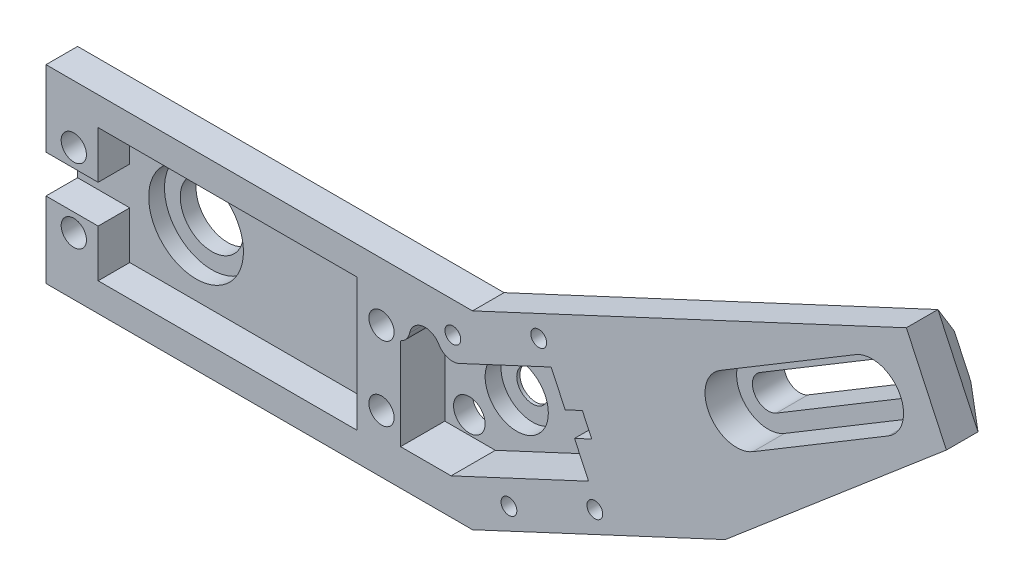
from build123d import *

# Parameters (mm, degrees)
SKETCH1_W                = 57.5
SKETCH1_H                = 30
BOSS_EXTRUDE1_DEPTH      = 30
SKETCH2_W                = 41
SKETCH2_H                = 21
CUT_EXTRUDE1_DEPTH       = 25
SKETCH8_R                = 2
CUT_EXTRUDE6_DEPTH       = 10
SKETCH10_R               = 5
CUT_EXTRUDE8_DEPTH       = 10
BOSS_EXTRUDE4_DEPTH      = 30
SKETCH16_R               = 5
CUT_EXTRUDE10_DEPTH      = 30
CHAMFER5_SIZE            = 5
SKETCH20_R               = 7.5
CUT_EXTRUDE13_DEPTH      = 2.5
CUT_EXTRUDE16_DEPTH      = 122.918629513
CUT_EXTRUDE16_DEPTH_BACK = 122.918629513
SKETCH30_W               = 142.5
SKETCH30_H               = 20
CUT_EXTRUDE17_DEPTH      = 7
CUT_EXTRUDE19_DEPTH      = 124.489525441
SKETCH35_R               = 2.5
CUT_EXTRUDE21_DEPTH      = 124.489525441
SKETCH37_W               = 8.25
SKETCH37_H               = 6
CUT_EXTRUDE23_DEPTH      = 5
CUT_EXTRUDE24_DEPTH      = 5
SKETCH40_R               = 5
CUT_EXTRUDE25_DEPTH      = 2.5
SKETCH41_R               = 2
CUT_EXTRUDE26_DEPTH      = 10
CUT_EXTRUDE27_DEPTH      = 7
FILLET3_R                = 2.5
FILLET4_R                = 2.5
SKETCH45_R               = 1.25
CUT_EXTRUDE28_DEPTH      = 124.489525441


with BuildPart() as part:
    # Sketch1 → Boss-Extrude1 (new body)
    with BuildSketch(Plane.XY):
        Rectangle(SKETCH1_W, SKETCH1_H)
    extrude(amount=BOSS_EXTRUDE1_DEPTH)

    # Sketch2 → Cut-Extrude1 (cut)
    with BuildSketch(Plane.XY.offset(30)):
        Rectangle(SKETCH2_W, SKETCH2_H)
    extrude(amount=-CUT_EXTRUDE1_DEPTH, mode=Mode.SUBTRACT)

    # Sketch8 → Cut-Extrude6 (cut)
    with BuildSketch(Plane.XY.offset(30)):
        with Locations((24.35, 6)):
            Circle(SKETCH8_R)
        with Locations(Location((24.35, -6, 0), (0, 0, 180))):
            Circle(SKETCH8_R)
        with Locations((-24.35, -6)):
            Circle(SKETCH8_R)
        with Locations(Location((-24.35, 6, 0), (0, 0, 180))):
            Circle(SKETCH8_R)
    extrude(amount=-CUT_EXTRUDE6_DEPTH, mode=Mode.SUBTRACT)

    # Sketch10 → Cut-Extrude8 (cut)
    with BuildSketch(Plane.XY.offset(5)):
        with Locations((-10, 0)):
            Circle(SKETCH10_R)
    extrude(amount=-CUT_EXTRUDE8_DEPTH, mode=Mode.SUBTRACT)

    # Sketch13 → Boss-Extrude4 (add)
    with BuildSketch(Plane.XY.offset(30)):
        Polygon((28.75, 15), (38.75, 15), (107.410726074, 47.017022383), (113.75, 33.422405577), (78.75, 3.652306326), (38.75, -15), (28.75, -15), align=None)
    extrude(amount=-BOSS_EXTRUDE4_DEPTH)

    # Sketch16 → Cut-Extrude10 (cut)
    with BuildSketch(Plane(origin=(1.175656739, -2.521204013, 0), x_dir=(0.9063077870366488, 0.42261826174070183, 0), z_dir=(-0.42261826174070183, 0.9063077870366488, 0))):
        with Locations(Location((97.217429724, -15, 0), (0, 0, 180))):
            Circle(SKETCH16_R)
        with BuildLine():
            Line((67.217429724, -12.5), (82.217429724, -12.5))
            ThreePointArc((82.217429724, -12.5), (84.717429724, -15), (82.217429724, -17.5))
            Line((82.217429724, -17.5), (67.217429724, -17.5))
            ThreePointArc((67.217429724, -17.5), (64.717429724, -15), (67.217429724, -12.5))
        make_face()
    extrude(amount=-CUT_EXTRUDE10_DEPTH, mode=Mode.SUBTRACT)

    # Chamfer5
    # the kernel refuses this chamfer: 5 mm, written as the material it takes off along each edge
    with BuildSketch(Plane(origin=(-28.75, 27.85841494, 0), x_dir=(-0.027495876610586317, 0, 0.9996219169112968), z_dir=(0, -1, 0))) as chamfer5_piece_1:
        Polygon((CHAMFER5_SIZE * 0.999621916911, -CHAMFER5_SIZE * 0.0274958766106), (-CHAMFER5_SIZE * 0.0274958766106, -CHAMFER5_SIZE * 0.999621916911), (0, 0), align=None)
    extrude(amount=55.71682988, mode=Mode.SUBTRACT)
    with BuildSketch(Plane(origin=(-41.60841494, -15, 0), x_dir=(0, -0.027495876610586317, 0.9996219169112968), z_dir=(1, 0, 0)), Plane(origin=(51.60841494, -15, 30), x_dir=(0, -0.027495876610586317, -0.9996219169112968), z_dir=(-1, 0, 0))) as chamfer5_piece_2:
        Polygon((CHAMFER5_SIZE * 0.999621916911, -CHAMFER5_SIZE * 0.0274958766106), (-CHAMFER5_SIZE * 0.0274958766106, -CHAMFER5_SIZE * 0.999621916911), (0, 0), align=None)
    extrude(amount=93.21682988, mode=Mode.SUBTRACT)
    with BuildSketch(Plane(origin=(90.403681589, 9.086507297, 30), x_dir=(-0.4224584769229526, 0.905965127389214, 0.02749587661058631), z_dir=(-0.9063077870366526, -0.4226182617406939, 0)), Plane(origin=(90.403681589, 9.086507297, 0), x_dir=(0.011620259578202724, -0.024919727083573626, 0.9996219169112968), z_dir=(-0.9063077870366526, -0.4226182617406939, 0))) as chamfer5_piece_3:
        Polygon((CHAMFER5_SIZE * 0.999621916911, CHAMFER5_SIZE * 0.0274958766106), (-CHAMFER5_SIZE * 0.0274958766106, CHAMFER5_SIZE * 0.999621916911), (0, 0), align=None)
    extrude(amount=69.851946638, mode=Mode.SUBTRACT)
    with BuildSketch(Plane(origin=(123.544555766, 41.753402643, 0), x_dir=(-0.6476573741944397, 0.7614354223576539, -0.027495876610586414), z_dir=(-0.7617234170999287, -0.6479023351104763, 0))) as chamfer5_piece_4:
        Polygon((CHAMFER5_SIZE * 0.999621916911, -CHAMFER5_SIZE * 0.0274958766106), (-CHAMFER5_SIZE * 0.0274958766106, -CHAMFER5_SIZE * 0.999621916911), (0, 0), align=None)
    extrude(amount=71.665266299, mode=Mode.SUBTRACT)
    with BuildSketch(Plane(origin=(123.544555766, 41.753402643, 30), x_dir=(-0.6476573741944397, 0.7614354223576539, 0.02749587661058634), z_dir=(-0.7617234170999287, -0.6479023351104763, 0))) as chamfer5_piece_5:
        Polygon((CHAMFER5_SIZE * 0.999621916911, CHAMFER5_SIZE * 0.0274958766106), (-CHAMFER5_SIZE * 0.0274958766106, CHAMFER5_SIZE * 0.999621916911), (0, 0), align=None)
    extrude(amount=71.665266299, mode=Mode.SUBTRACT)
    with BuildSketch(Plane(origin=(101.976525103, 58.670703972, 30), x_dir=(-0.9059651273892108, -0.42245847692295924, 0.027495876610586337), z_dir=(0.42261826174070055, -0.9063077870366495, 0))) as chamfer5_piece_6:
        Polygon((CHAMFER5_SIZE * 0.999621916911, CHAMFER5_SIZE * 0.0274958766106), (-CHAMFER5_SIZE * 0.0274958766106, CHAMFER5_SIZE * 0.999621916911), (0, 0), align=None)
    extrude(amount=40.71682988, mode=Mode.SUBTRACT)
    with BuildSketch(Plane(origin=(101.976525103, 58.670703972, 0), x_dir=(-0.9059651273892108, -0.42245847692295924, -0.027495876610586344), z_dir=(0.42261826174070055, -0.9063077870366495, 0))) as chamfer5_piece_7:
        Polygon((CHAMFER5_SIZE * 0.999621916911, -CHAMFER5_SIZE * 0.0274958766106), (-CHAMFER5_SIZE * 0.0274958766106, -CHAMFER5_SIZE * 0.999621916911), (0, 0), align=None)
    extrude(amount=40.71682988, mode=Mode.SUBTRACT)
    with BuildSketch(Plane(origin=(27.096318411, 9.565799029, 30), x_dir=(0.4224584769229604, -0.9059651273892103, 0.027495876610586313), z_dir=(0.9063077870366489, 0.4226182617407018, 0))) as chamfer5_piece_8_section:
        Polygon((CHAMFER5_SIZE * 0.999621916911, CHAMFER5_SIZE * 0.0274958766106), (-CHAMFER5_SIZE * 0.0274958766106, CHAMFER5_SIZE * 0.999621916911), (0, 0), align=None)
    chamfer5_piece_8 = extrude(amount=101.47555893, mode=Mode.PRIVATE)
    chamfer5_piece_8 = split(chamfer5_piece_8, bisect_by=Plane(origin=(81.150743587, 15, 28.329639499), z_dir=(0, 1, 0)), keep=Keep.TOP, mode=Mode.PRIVATE)
    add(chamfer5_piece_8, mode=Mode.SUBTRACT)
    with BuildSketch(Plane(origin=(27.096318411, 9.565799029, 0), x_dir=(0.4224584769229604, -0.9059651273892103, -0.02749587661058636), z_dir=(0.9063077870366489, 0.4226182617407018, 0))) as chamfer5_piece_9_section:
        Polygon((CHAMFER5_SIZE * 0.999621916911, -CHAMFER5_SIZE * 0.0274958766106), (-CHAMFER5_SIZE * 0.0274958766106, -CHAMFER5_SIZE * 0.999621916911), (0, 0), align=None)
    chamfer5_piece_9 = extrude(amount=101.47555893, mode=Mode.PRIVATE)
    chamfer5_piece_9 = split(chamfer5_piece_9, bisect_by=Plane(origin=(81.150743587, 15, 1.670360501), z_dir=(0, 1, 0)), keep=Keep.TOP, mode=Mode.PRIVATE)
    add(chamfer5_piece_9, mode=Mode.SUBTRACT)
    with BuildSketch(Plane(origin=(-41.60841494, 15, 0), x_dir=(0, -0.9996219169112968, -0.027495876610586372), z_dir=(1, 0, 0))) as chamfer5_piece_10_section:
        Polygon((CHAMFER5_SIZE * 0.999621916911, -CHAMFER5_SIZE * 0.0274958766106), (-CHAMFER5_SIZE * 0.0274958766106, -CHAMFER5_SIZE * 0.999621916911), (0, 0), align=None)
    chamfer5_piece_10 = extrude(amount=93.21682988, mode=Mode.PRIVATE)
    chamfer5_piece_10 = split(chamfer5_piece_10, bisect_by=Plane(origin=(3.719146846, -1.335155097, 1.672660276), z_dir=(-0.4226182617407018, 0.9063077870366489, 0)), keep=Keep.TOP, mode=Mode.PRIVATE)
    add(chamfer5_piece_10, mode=Mode.SUBTRACT)
    with BuildSketch(Plane(origin=(51.60841494, 15, 30), x_dir=(0, -0.9996219169112968, 0.027495876610586317), z_dir=(-1, 0, 0))) as chamfer5_piece_11_section:
        Polygon((CHAMFER5_SIZE * 0.999621916911, -CHAMFER5_SIZE * 0.0274958766106), (-CHAMFER5_SIZE * 0.0274958766106, -CHAMFER5_SIZE * 0.999621916911), (0, 0), align=None)
    chamfer5_piece_11 = extrude(amount=93.21682988, mode=Mode.PRIVATE)
    chamfer5_piece_11 = split(chamfer5_piece_11, bisect_by=Plane(origin=(3.719146846, -1.335155097, 28.327339724), z_dir=(-0.4226182617407018, 0.9063077870366489, 0)), keep=Keep.TOP, mode=Mode.PRIVATE)
    add(chamfer5_piece_11, mode=Mode.SUBTRACT)
    with BuildSketch(Plane(origin=(27.096318411, 9.565799029, 30), x_dir=(0.4224584769229604, -0.9059651273892103, 0.027495876610586313), z_dir=(0.9063077870366489, 0.4226182617407018, 0))) as chamfer5_piece_12a_section:
        Polygon((CHAMFER5_SIZE * 0.999621916911, CHAMFER5_SIZE * 0.0274958766106), (-CHAMFER5_SIZE * 0.0274958766106, CHAMFER5_SIZE * 0.999621916911), (0, 0), align=None)
    chamfer5_piece_12a = extrude(amount=101.47555893, mode=Mode.PRIVATE)
    chamfer5_piece_12a = split(chamfer5_piece_12a, bisect_by=Plane(origin=(35.512062488, 15, 28.462048788), z_dir=(0, -1, 0)), keep=Keep.TOP, mode=Mode.PRIVATE)
    with BuildSketch(Plane(origin=(51.60841494, 15, 30), x_dir=(0, -0.9996219169112968, 0.027495876610586317), z_dir=(-1, 0, 0))) as chamfer5_piece_12b_section:
        Polygon((CHAMFER5_SIZE * 0.999621916911, -CHAMFER5_SIZE * 0.0274958766106), (-CHAMFER5_SIZE * 0.0274958766106, -CHAMFER5_SIZE * 0.999621916911), (0, 0), align=None)
    chamfer5_piece_12b = extrude(amount=93.21682988, mode=Mode.PRIVATE)
    chamfer5_piece_12b = split(chamfer5_piece_12b, bisect_by=Plane(origin=(41.684567981, 16.368411523, 28.462048788), z_dir=(0.4226182617407018, -0.9063077870366489, 0)), keep=Keep.TOP, mode=Mode.PRIVATE)
    chamfer5_piece_12 = chamfer5_piece_12a & chamfer5_piece_12b
    add(chamfer5_piece_12, mode=Mode.SUBTRACT)
    with BuildSketch(Plane(origin=(27.096318411, 9.565799029, 0), x_dir=(0.4224584769229604, -0.9059651273892103, -0.02749587661058636), z_dir=(0.9063077870366489, 0.4226182617407018, 0))) as chamfer5_piece_13a_section:
        Polygon((CHAMFER5_SIZE * 0.999621916911, -CHAMFER5_SIZE * 0.0274958766106), (-CHAMFER5_SIZE * 0.0274958766106, -CHAMFER5_SIZE * 0.999621916911), (0, 0), align=None)
    chamfer5_piece_13a = extrude(amount=101.47555893, mode=Mode.PRIVATE)
    chamfer5_piece_13a = split(chamfer5_piece_13a, bisect_by=Plane(origin=(35.512062488, 15, 1.537951212), z_dir=(0, -1, 0)), keep=Keep.TOP, mode=Mode.PRIVATE)
    with BuildSketch(Plane(origin=(-41.60841494, 15, 0), x_dir=(0, -0.9996219169112968, -0.027495876610586372), z_dir=(1, 0, 0))) as chamfer5_piece_13b_section:
        Polygon((CHAMFER5_SIZE * 0.999621916911, -CHAMFER5_SIZE * 0.0274958766106), (-CHAMFER5_SIZE * 0.0274958766106, -CHAMFER5_SIZE * 0.999621916911), (0, 0), align=None)
    chamfer5_piece_13b = extrude(amount=93.21682988, mode=Mode.PRIVATE)
    chamfer5_piece_13b = split(chamfer5_piece_13b, bisect_by=Plane(origin=(41.684567981, 16.368411523, 1.537951212), z_dir=(0.4226182617407018, -0.9063077870366489, 0)), keep=Keep.TOP, mode=Mode.PRIVATE)
    chamfer5_piece_13 = chamfer5_piece_13a & chamfer5_piece_13b
    add(chamfer5_piece_13, mode=Mode.SUBTRACT)

    # Sketch20 → Cut-Extrude13 (cut)
    with BuildSketch(Plane.XY.offset(5)):
        with Locations((-10, 0)):
            Circle(SKETCH20_R)
    extrude(amount=-CUT_EXTRUDE13_DEPTH, mode=Mode.SUBTRACT)

    # Sketch30 → Cut-Extrude16 (cut, two sides: drawn at the far end of the back side and taken through both)
    with BuildSketch(Plane(origin=(0, 15, 0), x_dir=(1, 0, 0), z_dir=(0, 1, 0)).offset(-CUT_EXTRUDE16_DEPTH_BACK)):
        with Locations((42.5, -20)):
            Rectangle(SKETCH30_W, SKETCH30_H)
    extrude(amount=CUT_EXTRUDE16_DEPTH + CUT_EXTRUDE16_DEPTH_BACK, mode=Mode.SUBTRACT)

    # Sketch31 → Cut-Extrude17 (cut)
    with BuildSketch(Plane.XY.offset(10)):
        Polygon((29.447517659, 3.385826677), (31.666263533, -1.372289205), (53.417650422, 8.770549077), (51.198904547, 13.528664959), align=None)
        Polygon((54.896814338, 5.598471822), (33.145427449, -4.544366459), (35.364173323, -9.302482341), (57.115560212, 0.84035594), align=None)
        Polygon((28.947340172, -2.64014399), (30.426504088, -5.812221245), (33.145427449, -4.544366459), (31.666263533, -1.372289205), align=None)
        Polygon((31.666263533, -1.372289205), (33.145427449, -4.544366459), (54.896814338, 5.598471822), (53.417650422, 8.770549077), align=None)
        Polygon((53.417650422, 8.770549077), (54.896814338, 5.598471822), (57.615737699, 6.866326607), (56.136573783, 10.038403862), align=None)
    extrude(amount=-CUT_EXTRUDE17_DEPTH, mode=Mode.SUBTRACT)

    # Sketch33 → Cut-Extrude19 (cut, through all)
    with BuildSketch(Plane.XY):
        with BuildLine():
            Line((81.832816008, 20.029861583), (103.261998525, 32.905813456))
            ThreePointArc((103.261998525, 32.905813456), (104.11732159, 36.336326895), (100.686808151, 37.19164996))
            Line((100.686808151, 37.19164996), (79.257625633, 24.315698087))
            ThreePointArc((79.257625633, 24.315698087), (78.402302569, 20.885184648), (81.832816008, 20.029861583))
        make_face()
    extrude(amount=CUT_EXTRUDE19_DEPTH, mode=Mode.SUBTRACT)

    # Sketch35 → Cut-Extrude21 (cut, through all)
    with BuildSketch(Plane(origin=(0, 0, 0), x_dir=(-1, 0, 0), z_dir=(0, 0, -1))):
        with Locations((-38.75, 0)):
            Circle(SKETCH35_R)
        with Locations((-31.25, -6.5)):
            Circle(SKETCH35_R)
        with Locations(Location((-31.25, 6.5, 0), (0, 0, 279.486964522))):
            Circle(SKETCH35_R)
    extrude(amount=-CUT_EXTRUDE21_DEPTH, mode=Mode.SUBTRACT)

    # Sketch37 → Cut-Extrude23 (cut)
    with BuildSketch(Plane.XY.offset(10)):
        with Locations((-24.625, 0)):
            Rectangle(SKETCH37_W, SKETCH37_H)
    extrude(amount=-CUT_EXTRUDE23_DEPTH, mode=Mode.SUBTRACT)

    # Sketch38 → Cut-Extrude24 (cut)
    with BuildSketch(Plane.XY.offset(10)):
        with BuildLine():
            Line((77.970030446, 26.458616339), (99.399212963, 39.334568211))
            ThreePointArc((99.399212963, 39.334568211), (106.260239841, 37.623922082), (104.549593712, 30.762895204))
            Line((104.549593712, 30.762895204), (83.120411195, 17.886943332))
            ThreePointArc((83.120411195, 17.886943332), (76.259384317, 19.597589461), (77.970030446, 26.458616339))
        make_face()
    extrude(amount=-CUT_EXTRUDE24_DEPTH, mode=Mode.SUBTRACT)

    # Sketch40 → Cut-Extrude25 (cut)
    with BuildSketch(Plane.XY.offset(3)):
        with Locations((38.75, 0)):
            Circle(SKETCH40_R)
    extrude(amount=-CUT_EXTRUDE25_DEPTH, mode=Mode.SUBTRACT)

    # Sketch41 → Cut-Extrude26 (cut)
    with BuildSketch(Plane.XY.offset(10)):
        with Locations((-24.35, 5.85)):
            Circle(SKETCH41_R)
        with Locations(Location((-24.35, -5.85, 0), (0, 0, 287.457603124))):
            Circle(SKETCH41_R)
        with Locations((24.35, -5.85)):
            Circle(SKETCH41_R)
        with Locations(Location((24.35, 5.85, 0), (0, 0, 180))):
            Circle(SKETCH41_R)
    extrude(amount=-CUT_EXTRUDE26_DEPTH, mode=Mode.SUBTRACT)

    # Sketch44 → Cut-Extrude27 (cut)
    with BuildSketch(Plane.XY.offset(10)):
        Polygon((27.364173323, -9.302482341), (35.364173323, -9.302482341), (33.364173323, 5.212193208), (27.364173323, 5.212193208), align=None)
    extrude(amount=-CUT_EXTRUDE27_DEPTH, mode=Mode.SUBTRACT)

    # Fillet3
    fillet3_edges = [part.edges().sort_by_distance(p)[0] for p in [
        (33.403784168, 5.230664048, 6.5),
    ]]
    fillet(fillet3_edges, radius=FILLET3_R)

    # Fillet4
    # the kernel refuses this fillet: 2.5 mm, written as the material it takes off along each edge
    with BuildSketch(Plane(origin=(29.107208908, 5.212193208, 14.531796065), x_dir=(-0.1693351073344651, 0.985558532723463, 0), z_dir=(0, 0, -1))) as fillet4_piece_1:
        with BuildLine():
            CenterArc((2.719077639, -2.329916946), FILLET4_R, 111.256494855, 54.572229345)
            Line((0.295157118, -1.717863593), (0.246678707, -1.705622526))
            ThreePointArc((0.246678707, -1.705622526), (0.098300632, -0.867398552), (-0.049277927, -0.008466755))
            Line((-0.049277927, -0.008466755), (0.018127184, 0.046598339))
            ThreePointArc((0.018127184, 0.046598339), (0.906359213, -0.120083054), (1.794591242, 0.046598339))
            Line((1.794591242, 0.046598339), (1.812718426, 0))
        make_face()
    extrude(amount=11.531796065, mode=Mode.SUBTRACT)

    # Sketch45 → Cut-Extrude28 (cut, through all)
    with BuildSketch(Plane.XY.offset(10)):
        with Locations((49.235033159, 16.474719407)):
            Circle(SKETCH45_R)
        with Locations(Location((35.640416354, 10.135445481, 0), (0, 0, 353.779422979))):
            Circle(SKETCH45_R)
        with Locations(Location((58.110016656, -2.557744121, 0), (0, 0, 295))):
            Circle(SKETCH45_R)
        with Locations((44.51539985, -8.897018047)):
            Circle(SKETCH45_R)
    extrude(amount=-CUT_EXTRUDE28_DEPTH, mode=Mode.SUBTRACT)


solid = part.part
